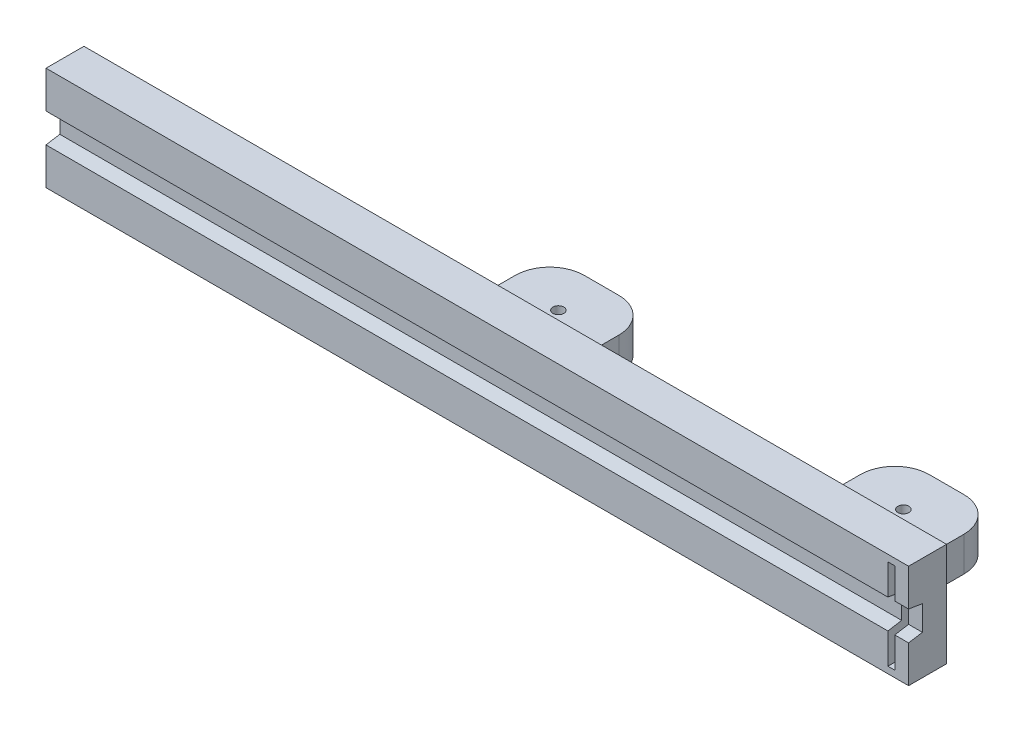
from build123d import *

# Parameters (mm, degrees)
SKETCH_1_W          = 250
SKETCH_1_H          = 30
EXTRUDE_1_DEPTH     = 11
SKETCH_4_W          = 30
SKETCH_4_H          = 10
EXTRUDE_2_DEPTH     = 25
CUT_EXTRUDE_2_DEPTH = 254.031618578
SKETCH_6_R          = 1.6
CUT_EXTRUDE_3_DEPTH = 253.041663223
EXTRUDE_4_DEPTH     = 25
SKETCH_12_R         = 1.6
CUT_EXTRUDE_5_DEPTH = 253.041663223
FILLET_1_R          = 10
SKETCH_13_W         = 2
SKETCH_13_H         = 26.2
CUT_EXTRUDE_6_DEPTH = 7


with BuildPart() as part:
    # 草圖1 → 填料-伸長1 (new body)
    with BuildSketch(Plane.XY):
        with Locations((125, 15)):
            Rectangle(SKETCH_1_W, SKETCH_1_H)
    extrude(amount=EXTRUDE_1_DEPTH)

    # 草圖4 → 填料-伸長2 (add)
    with BuildSketch(Plane(origin=(0, 0, 0), x_dir=(-1, 0, 0), z_dir=(0, 0, -1))):
        with Locations((-125, 15)):
            Rectangle(SKETCH_4_W, SKETCH_4_H)
    extrude(amount=EXTRUDE_2_DEPTH)

    # 草圖5 → 除料-伸長2 (cut, through all)
    with BuildSketch(Plane(origin=(250, 0, 0), x_dir=(0, 0, -1), z_dir=(1, 0, 0))):
        Polygon((-11, 19.25), (-11, 10.75), (-7, 11.402039536), (-7, 18.6), align=None)
    extrude(amount=-CUT_EXTRUDE_2_DEPTH, mode=Mode.SUBTRACT)

    # 草圖6 → 除料-伸長3 (cut, through all)
    with BuildSketch(Plane.XZ.offset(-10)):
        with Locations((125, -12.5)):
            Circle(SKETCH_6_R)
    extrude(amount=-CUT_EXTRUDE_3_DEPTH, mode=Mode.SUBTRACT)

    # 草圖11 → 填料-伸長4 (add)
    with BuildSketch(Plane(origin=(0, 0, 0), x_dir=(-1, 0, 0), z_dir=(0, 0, -1))):
        Polygon((-240, 20), (-240, 10), (-210, 10), (-210, 15), (-210, 20), align=None)
    extrude(amount=EXTRUDE_4_DEPTH)

    # 草圖12 → 除料-伸長5 (cut, through all)
    with BuildSketch(Plane(origin=(0, 20, 0), x_dir=(1, 0, 0), z_dir=(0, 1, 0))):
        with Locations((225, 12.5)):
            Circle(SKETCH_12_R)
    extrude(amount=-CUT_EXTRUDE_5_DEPTH, mode=Mode.SUBTRACT)

    # 圓角1
    fillet_1_edges = [part.edges().sort_by_distance(p)[0] for p in [
        (110, 15, -25),
        (140, 15, -25),
        (210, 15, -25),
        (240, 15, -25),
    ]]
    fillet(fillet_1_edges, radius=FILLET_1_R)

    # 草圖13 → 除料-伸長6 (cut)
    with BuildSketch(Plane.XY.offset(11)):
        with Locations((245, 15)):
            Rectangle(SKETCH_13_W, SKETCH_13_H)
    extrude(amount=-CUT_EXTRUDE_6_DEPTH, mode=Mode.SUBTRACT)


solid = part.part
